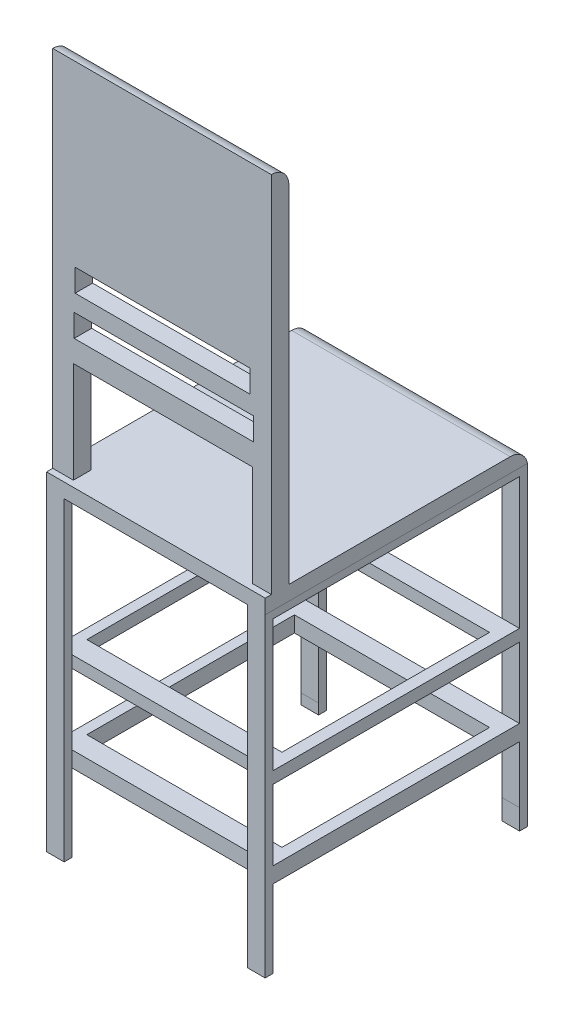
from build123d import *

# Parameters (mm, degrees)
SKETCH1_W                = 25.4
SKETCH1_H                = 381
BOSS_EXTRUDE1_DEPTH      = 457.2
BOSS_EXTRUDE1_2_DEPTH    = 457.2
SKETCH5_W                = 358.329211732
SKETCH5_H                = 431.015208417
CUT_EXTRUDE1_DEPTH       = 457.2
BOSS_EXTRUDE7_DEPTH      = 35.814
BOSS_EXTRUDE7_DEPTH_BACK = 281.94
SKETCH13_W               = 381.141342185
SKETCH13_H               = 21.019014934
SKETCH14_W               = 317.754
SKETCH14_H               = 526.086170676
BOSS_EXTRUDE8_DEPTH      = 25.4
SKETCH17_W               = 260.552131225
SKETCH17_H               = 146.876016362
SKETCH17_H_2             = 29.104227424
CUT_EXTRUDE3_DEPTH       = 25.4
BOSS_EXTRUDE9_DEPTH      = 25.4
SKETCH19_W               = 260.972204044
SKETCH19_H               = 32.78881538
SKETCH19_W_2             = 254
CUT_EXTRUDE6_DEPTH       = 35.56
FILLET1_R                = 25.4
FILLET2_R                = 25.4
SKETCH20_W               = 358.469269341
SKETCH20_H               = 15.323983409
CUT_EXTRUDE7_DEPTH       = 288.544
SKETCH21_W               = 358.469269341
SKETCH21_H               = 29.641446852
CUT_EXTRUDE8_DEPTH       = 80.772
BOSS_EXTRUDE10_START     = -279.146
SKETCH22_W               = 358.329211732
SKETCH22_H               = 17.235921955
SKETCH22_H_2             = 22.86
BOSS_EXTRUDE10_DEPTH     = 314.887549
CUT_EXTRUDE9_DEPTH       = 378.46
CUT_EXTRUDE9_DEPTH_BACK  = 279.146
SKETCH23_W               = 283.569919334
SKETCH23_H               = 301.695006961
SKETCH24_W               = 411.753611465
SKETCH24_H               = 408.769889643
CUT_EXTRUDE11_DEPTH      = 75.946
FILLET3_R                = 25.4


# Some blends are built 0.0001 mm under size
with BuildPart() as part:
    # Sketch1 → Boss-Extrude1 (new body)
    with BuildSketch(Plane(origin=(0, 0, 0), x_dir=(1, 0, 0), z_dir=(0, 1, 0))):
        with Locations((-269.080936413, 156.123579529)):
            Rectangle(SKETCH1_W, SKETCH1_H)
    extrude(amount=BOSS_EXTRUDE1_DEPTH)


with BuildPart() as body_2:
    # Sketch1 → Boss-Extrude1 2 (new body)
    with BuildSketch(Plane(origin=(0, 0, 0), x_dir=(1, 0, 0), z_dir=(0, 1, 0))):
        with Locations((23.041549082, 156.123579529)):
            Rectangle(SKETCH1_W, SKETCH1_H)
    extrude(amount=BOSS_EXTRUDE1_2_DEPTH)


with BuildPart() as cut_extrude1_tool:
    # Sketch5 → Cut-Extrude1 (new body)
    with BuildSketch(Plane(origin=(35.741549082, 0, 0), x_dir=(0, 0, -1), z_dir=(1, 0, 0))):
        with Locations((156.123579529, 230.831587618)):
            Rectangle(SKETCH5_W, SKETCH5_H)
    extrude(amount=-CUT_EXTRUDE1_DEPTH)


with BuildPart() as part_1:
    add(part.part)

    # Cut-Extrude1: cut by cut_extrude1_tool
    add(cut_extrude1_tool.part, mode=Mode.SUBTRACT)



with BuildPart() as body_2_1:
    add(body_2.part)

    # Cut-Extrude1: cut by cut_extrude1_tool
    add(cut_extrude1_tool.part, mode=Mode.SUBTRACT)


with BuildPart() as part_2:
    add(part_1.part)

    add(body_2_1.part)  # Boss-Extrude7 merges body 2
    # Sketch13 → Boss-Extrude7 (add, two sides: drawn at the far end of the back side and taken through both)
    with BuildSketch(Plane(origin=(0, 0, 0), x_dir=(0, 0, -1), z_dir=(1, 0, 0)).offset(-BOSS_EXTRUDE7_DEPTH_BACK)):
        with Locations((156.194250622, 467.709507467)):
            Rectangle(SKETCH13_W, SKETCH13_H)
    extrude(amount=BOSS_EXTRUDE7_DEPTH + BOSS_EXTRUDE7_DEPTH_BACK)

    # Sketch14 → Boss-Extrude8 (add)
    with BuildSketch(Plane.XY):
        with Locations((-123.063, 730.752592805)):
            Rectangle(SKETCH14_W, SKETCH14_H)
    extrude(amount=BOSS_EXTRUDE8_DEPTH)

    # Sketch17 → Cut-Extrude3 (cut)
    with BuildSketch(Plane.XY.offset(25.4)):
        with Locations((-121.677084409, 551.657023115)):
            Rectangle(SKETCH17_W, SKETCH17_H)
        with Locations((-121.677084409, 663.207710066)):
            Rectangle(SKETCH17_W, SKETCH17_H_2)
        with Locations((-121.677084409, 710.328840181)):
            Rectangle(SKETCH17_W, SKETCH17_H_2)
    extrude(amount=-CUT_EXTRUDE3_DEPTH, mode=Mode.SUBTRACT)

    # Sketch18 → Boss-Extrude9 (add)
    with BuildSketch(Plane.XY):
        Polygon((-281.94, 993.795678143), (-281.94, 1247.795678143), (35.814, 1247.795678143), (35.814, 993.795678143), (35.814, 478.219014934), (8.598981204, 478.219014934), (8.598981204, 625.095031296), (-251.953150021, 625.095031296), (-251.953150021, 478.219014934), (-281.94, 478.219014934), align=None)
    extrude(amount=BOSS_EXTRUDE9_DEPTH)

    # Sketch19 → Cut-Extrude6 (cut)
    with BuildSketch(Plane.XY):
        with Locations((-120.300778352, 673.69810694)):
            Rectangle(SKETCH19_W, SKETCH19_H)
        with Locations((-122.448561379, 731.24582373)):
            Rectangle(SKETCH19_W_2, SKETCH19_H)
    extrude(amount=CUT_EXTRUDE6_DEPTH, mode=Mode.SUBTRACT)

    # Fillet1
    fillet1_edges = [part_2.edges().sort_by_distance(p)[0] for p in [
        (-123.063, 1247.795678143, 0),
    ]]
    fillet(fillet1_edges, radius=FILLET1_R - 0.0001)  # a hair under: the kernel refuses the full size

    # Fillet2
    # the kernel refuses this fillet: 25.4 mm, written as the material it takes off along each edge
    with BuildSketch(Plane(origin=(-344.488329806, 478.219014934, -346.764921714), x_dir=(0, 0, 1), z_dir=(1, 0, 0))) as fillet2_piece_1:
        with BuildLine():
            CenterArc((25.019331923, 25.4), FILLET2_R, 189.932027033, 80.067972967)
            Line((0, 21.019014934), (-0.500386638, 20.931395233))
            ThreePointArc((-0.500386638, 20.931395233), (-0.508, 10.509507467), (-0.508, 0))
            Line((-0.508, 0), (0, -0.508))
            Line((0, -0.508), (25.019331923, -0.508))
            Line((25.019331923, -0.508), (25.019331923, 0))
        make_face()
    extrude(amount=442.850659613, mode=Mode.SUBTRACT)

    # Sketch20 → Cut-Extrude7 (cut)
    with BuildSketch(Plane(origin=(0, 0, 0), x_dir=(0, 0, -1), z_dir=(1, 0, 0))):
        with Locations((156.193608334, 7.661991705)):
            Rectangle(SKETCH20_W, SKETCH20_H)
    extrude(amount=-CUT_EXTRUDE7_DEPTH, mode=Mode.SUBTRACT)

    # Sketch21 → Cut-Extrude8 (cut)
    with BuildSketch(Plane(origin=(0, 0, 0), x_dir=(0, 0, -1), z_dir=(1, 0, 0))):
        with Locations((156.193608334, 14.820723426)):
            Rectangle(SKETCH21_W, SKETCH21_H)
    extrude(amount=CUT_EXTRUDE8_DEPTH, mode=Mode.SUBTRACT)

    # Sketch22 → Boss-Extrude10 (add)
    with BuildSketch(Plane(origin=(0, 0, 0), x_dir=(0, 0, -1), z_dir=(1, 0, 0)).offset(BOSS_EXTRUDE10_START)):
        with Locations((156.123579529, 246.608280317)):
            Rectangle(SKETCH22_W, SKETCH22_H)
        with Locations((156.123579529, 124.076015291)):
            Rectangle(SKETCH22_W, SKETCH22_H_2)
    extrude(amount=BOSS_EXTRUDE10_DEPTH)

    # Sketch23 → Cut-Extrude9 (cut, two sides: drawn at the far end of the back side and taken through both)
    with BuildSketch(Plane(origin=(0, 0, 0), x_dir=(1, 0, 0), z_dir=(0, 1, 0)).offset(-CUT_EXTRUDE9_DEPTH_BACK)):
        with Locations((-122.770659877, 157.655951237)):
            Rectangle(SKETCH23_W, SKETCH23_H)
    extrude(amount=CUT_EXTRUDE9_DEPTH + CUT_EXTRUDE9_DEPTH_BACK, mode=Mode.SUBTRACT)

    # Sketch24 → Cut-Extrude11 (cut)
    with BuildSketch(Plane.XY.offset(25.4)):
        with Locations((-113.714072953, 1211.167180329)):
            Rectangle(SKETCH24_W, SKETCH24_H)
    extrude(amount=-CUT_EXTRUDE11_DEPTH, mode=Mode.SUBTRACT)

    # Fillet3
    fillet3_edges = [part_2.edges().sort_by_distance(p)[0] for p in [
        (-123.063, 1006.782235507, 0),
    ]]
    fillet(fillet3_edges, radius=FILLET3_R - 0.0001)  # a hair under: the kernel refuses the full size


solid = part_2.part
